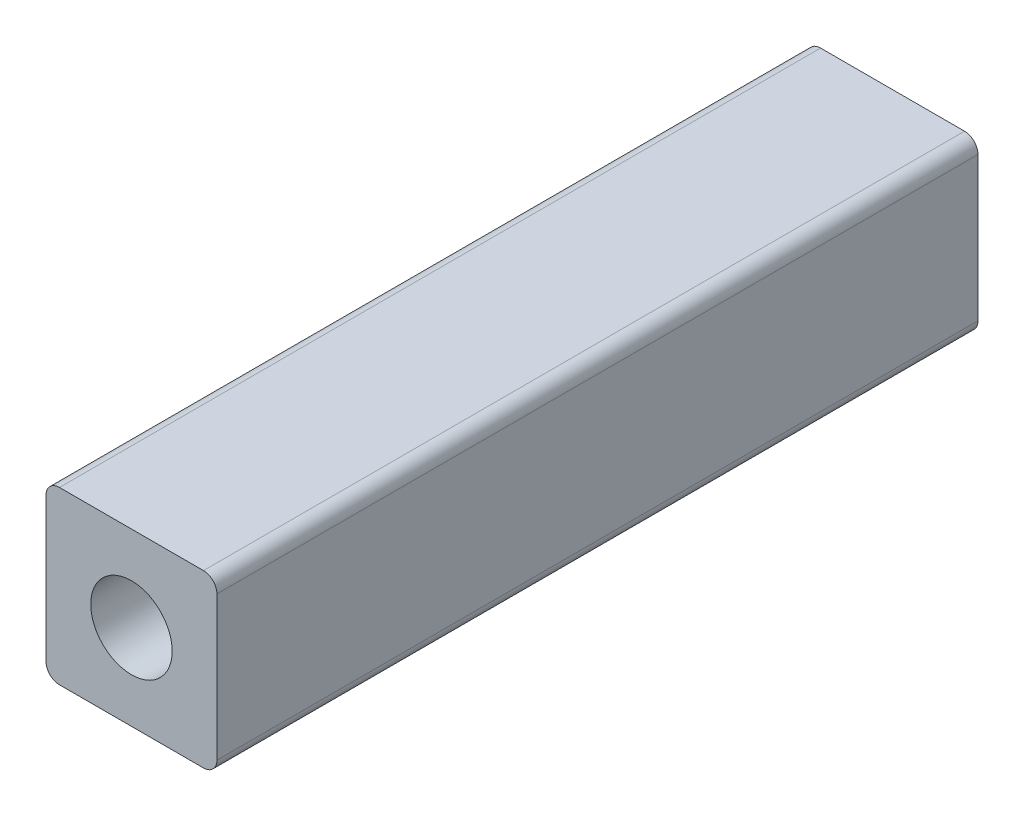
from build123d import *

# Parameters (mm, degrees)
SKETCH1_W           = 12.7
SKETCH1_H           = 12.7
SKETCH1_R           = 3.025
BOSS_EXTRUDE1_DEPTH = 28.275
FILLET2_R           = 1


with BuildPart() as part:
    # Sketch1 → Boss-Extrude1 (new, symmetric)
    with BuildSketch(Plane.XY):
        Rectangle(SKETCH1_W, SKETCH1_H)
        Circle(SKETCH1_R, mode=Mode.SUBTRACT)
    extrude(amount=BOSS_EXTRUDE1_DEPTH, both=True)

    # Fillet2
    fillet2_edges = [part.edges().sort_by_distance(p)[0] for p in [
        (-6.35, -6.35, 0),
        (-6.35, 6.35, 0),
        (6.35, 6.35, 0),
        (6.35, -6.35, 0),
    ]]
    fillet(fillet2_edges, radius=FILLET2_R)


solid = part.part
